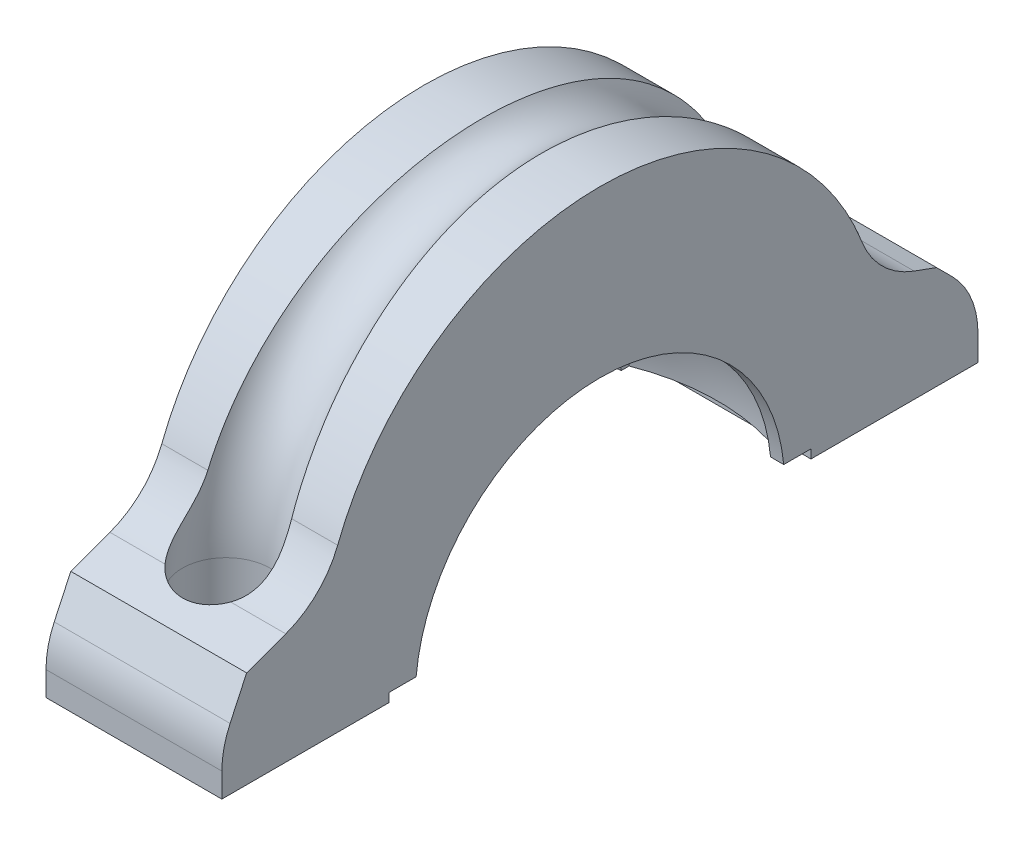
from build123d import *
from OCP.BRepFilletAPI import BRepFilletAPI_MakeChamfer

# Parameters (mm, degrees)
BOSS_EXTRUDE1_DEPTH = 20
FILLET1_R           = 10
CHAMFER1_SIZE       = 3
CHAMFER1_SIZE2      = 5.019471555
SKETCH5_R           = 5
FILLET4_R           = 10


with BuildPart() as part:
    # Sketch1 → Boss-Extrude1 (new body)
    with BuildSketch(Plane(origin=(0, 0, 0), x_dir=(0, 0, -1), z_dir=(1, 0, 0))):
        with BuildLine():
            Line((-86, 0), (-67, 0))
            Line((-67, 0), (-67, 1))
            Line((-67, 1), (-19, 1))
            Line((-19, 1), (-19, 0))
            Line((-19, 0), (0, 0))
            Line((0, 0), (0, 10))
            Line((0, 10), (-11.889492676, 14.327421434))
            ThreePointArc((-11.889492676, 14.327421434), (-43, 38.835002999), (-74.110507324, 14.327421434))
            Line((-74.110507324, 14.327421434), (-86, 10))
            Line((-86, 10), (-86, 0))
        make_face()
    extrude(amount=BOSS_EXTRUDE1_DEPTH)

    # Fillet1
    fillet1_edges = [part.edges().sort_by_distance(p)[0] for p in [
        (10, 14.327421434, 11.889492676),
        (10, 14.327421434, 74.110507324),
    ]]
    fillet(fillet1_edges, radius=FILLET1_R)

    # Chamfer1: one chamfer whose edges measure the first distance from different faces: ONE call of the kernel's chamfer builder (chamfer() names one face for all edges)
    chamfer1_edges_1 = [part.edges().sort_by_distance(p)[0] for p in [
        (10, 10, 0),
    ]]
    chamfer1_side_1 = [part.faces().sort_by_distance(p)[0] for p in [
        (10, 5, 0),
    ]]
    chamfer1_edges_2 = [part.edges().sort_by_distance(p)[0] for p in [
        (10, 10, 86),
    ]]
    chamfer1_side_2 = [part.faces().sort_by_distance(p)[0] for p in [
        (10, 11.323089013, 82.364842814),
    ]]
    chamfer1 = BRepFilletAPI_MakeChamfer(part.part.solid().wrapped)
    for e in chamfer1_edges_1:
        chamfer1.Add(CHAMFER1_SIZE, CHAMFER1_SIZE2, e.wrapped, chamfer1_side_1[0].wrapped)  # the first distance lies on this face
    for e in chamfer1_edges_2:
        chamfer1.Add(CHAMFER1_SIZE, CHAMFER1_SIZE2, e.wrapped, chamfer1_side_2[0].wrapped)  # the first distance lies on this face
    add(Compound.cast(chamfer1.Shape()), mode=Mode.REPLACE)

    # augu cut: sweep along a path in Sketch2
    with BuildLine(Plane(origin=(10, 0, 0), x_dir=(0, 0, -1), z_dir=(1, 0, 0))) as augu_cut_path:
        Line((-10.5, -11.403017839), (-10.5, 10))
        ThreePointArc((-10.5, 10), (-43, 42.5), (-75.5, 10))
        Line((-75.5, 10), (-75.5, -11.403017839))
    # Sketch5 → augu cut (sweep, cut)
    with BuildSketch(Plane(origin=(0, -11.403017839, 0), x_dir=(-1, 0, 0), z_dir=(0, -1, 0))):
        with Locations((-10, -10.5)):
            Circle(SKETCH5_R)
    sweep(path=augu_cut_path.line, mode=Mode.SUBTRACT)

    # Sketch6 → Cut-Revolve2 (revolve, cut)
    with BuildSketch(Plane.XZ.offset(1)):
        with BuildLine():
            Line((0, 64), (1.5, 64))
            Line((1.5, 64), (1.5, 64.9089023))
            ThreePointArc((1.5, 64.9089023), (10, 66.5), (18.5, 64.9089023))
            Line((18.5, 64.9089023), (18.5, 64))
            Line((18.5, 64), (20, 64))
            Line((20, 64), (20, 43))
            Line((20, 43), (0, 43))
            Line((0, 43), (0, 64))
        make_face()
    revolve(axis=Axis((0, -1, 43), (1, 0, 0)), mode=Mode.SUBTRACT)

    # Fillet4
    fillet4_edges = [part.edges().sort_by_distance(p)[0] for p in [
        (10, 4.980528445, 86),
        (10, 7, 0),
    ]]
    fillet(fillet4_edges, radius=FILLET4_R)


solid = part.part
